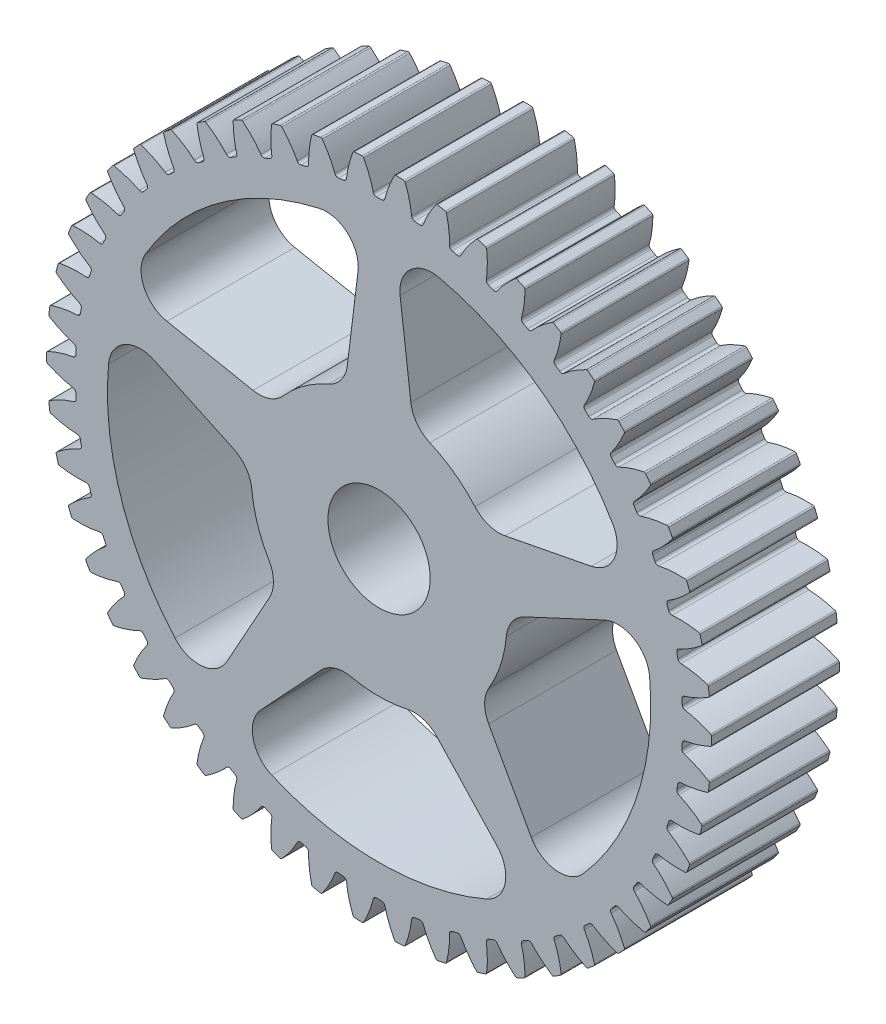
from build123d import *

# Parameters (mm, degrees)
SKETCH1_R                            = 33.02
BOSS_EXTRUDE1_DEPTH                  = 12.7
CUT_EXTRUDE_DCGTBC_DEPTH             = 49.393499563
FILLET_DCGTBC_R                      = 0.16191473
CIRPATTERN_DCGTBC_COUNT              = 50
FILLET_DCGTBC_OF_CIRPATTERN_DCGTBC_R = 0.16191473
SKETCH4_R                            = 4.7625
CUT_EXTRUDE2_DEPTH                   = 49.364303257
SKETCH5_R                            = 5.08
CUT_EXTRUDE3_DEPTH                   = 49.364303257
SKETCH6_R                            = 6.35
SKETCH6_R_2                          = 5.08
CUT_EXTRUDE4_DEPTH                   = 3.96875
CUT_EXTRUDE5_DEPTH                   = 49.364303257
FILLET1_R                            = 3.175


with BuildPart() as part:
    # Sketch1 → Boss-Extrude1 (new body)
    with BuildSketch(Plane.XY):
        Circle(SKETCH1_R)
    extrude(amount=BOSS_EXTRUDE1_DEPTH)

    # DCGTBC → Cut-Extrude-DCGTBC (cut, through all)
    with BuildSketch(Plane.XY):
        with BuildLine():
            add(Edge.make_bspline(
                [(0.580563674, 30.415867631), (0.583289779, 30.428308104), (0.591527209, 30.465389739), (0.605758164, 30.527010733), (0.626764487, 30.612909528), (0.657677609, 30.731586879), (0.69734407, 30.873764958), (0.747497392, 31.039747054), (0.808852297, 31.227743858), (0.876172182, 31.419057191), (0.946350906, 31.60706571), (1.021787923, 31.796724882), (1.097987154, 31.980017762), (1.181782633, 32.170079463), (1.26149249, 32.34535112), (1.355946347, 32.541342943), (1.433673918, 32.699400855), (1.518265424, 32.8623493), (1.560071309, 32.941609138), (1.581704198, 32.982095322)],
                knots=[0.16040477, 0.16040477, 0.16040477, 0.16040477, 0.16040477, 0.174208854, 0.201574956, 0.228941013, 0.256307345, 0.307035032, 0.361767352, 0.416499661, 0.471231937, 0.525964282, 0.580696616, 0.635428982, 0.690161387, 0.744893688, 0.799626082, 0.854358407, 0.909090914, 0.909090914, 0.909090914, 0.909090914, 0.909090914], degree=4))
            ThreePointArc((1.581704198, 32.982095322), (0, 33.02), (-1.581704198, 32.982095322))
            add(Edge.make_bspline(
                [(-0.580563674, 30.415867631), (-0.583289779, 30.428308104), (-0.591527209, 30.465389739), (-0.605758164, 30.527010733), (-0.626764487, 30.612909528), (-0.657677609, 30.731586879), (-0.69734407, 30.873764958), (-0.747497392, 31.039747054), (-0.808852297, 31.227743858), (-0.876172182, 31.419057191), (-0.946350906, 31.60706571), (-1.021787923, 31.796724882), (-1.097987154, 31.980017762), (-1.181782633, 32.170079463), (-1.26149249, 32.34535112), (-1.355946347, 32.541342943), (-1.433673918, 32.699400855), (-1.518265424, 32.8623493), (-1.560071309, 32.941609138), (-1.581704198, 32.982095322)],
                knots=[0.16040477, 0.16040477, 0.16040477, 0.16040477, 0.16040477, 0.174208854, 0.201574956, 0.228941013, 0.256307345, 0.307035032, 0.361767352, 0.416499661, 0.471231937, 0.525964282, 0.580696616, 0.635428982, 0.690161387, 0.744893688, 0.799626082, 0.854358407, 0.909090914, 0.909090914, 0.909090914, 0.909090914, 0.909090914], degree=4))
            ThreePointArc((-0.580563674, 30.415867631), (-0.466145503, 30.232005197), (-0.261433127, 30.161366994))
            ThreePointArc((-0.261433127, 30.161366994), (0, 30.1625), (0.261433127, 30.161366994))
            ThreePointArc((0.261433127, 30.161366994), (0.466145503, 30.232005197), (0.580563674, 30.415867631))
        make_face()
    cut_extrude_dcgtbc = extrude(amount=CUT_EXTRUDE_DCGTBC_DEPTH, mode=Mode.SUBTRACT)

    # Fillet-DCGTBC
    fillet_dcgtbc_edges = [part.edges().sort_by_distance(p)[0] for p in [
        (1.581704198, 32.982095322, 6.35),
        (-1.581704198, 32.982095322, 6.35),
    ]]
    fillet(fillet_dcgtbc_edges, radius=FILLET_DCGTBC_R)

    # CirPattern-DCGTBC: Cut-Extrude-DCGTBC ×50 about axis
    cirpattern_dcgtbc_axis = Axis((0, 0, 12.7), (0, 0, 1))
    for i in range(1, CIRPATTERN_DCGTBC_COUNT):
        add(cut_extrude_dcgtbc.rotate(cirpattern_dcgtbc_axis, i * 360 / CIRPATTERN_DCGTBC_COUNT), mode=Mode.SUBTRACT)

    # Fillet-DCGTBC of CirPattern-DCGTBC
    fillet_dcgtbc_of_cirpattern_dcgtbc_edges = [part.edges().sort_by_distance(p)[0] for p in [
        (-2.564520668, 32.920261751, 6.35),
        (-5.702984645, 32.523781547, 6.35),
        (-6.670301512, 32.339255986, 6.35),
        (-9.734325616, 31.552548309, 6.35),
        (-10.670887716, 31.248240836, 6.35),
        (-13.612150458, 30.083712535, 6.35),
        (-14.503187646, 29.664422261, 6.35),
        (-17.275303556, 28.140438644, 6.35),
        (-18.106763644, 27.612778027, 6.35),
        (-20.666014796, 25.753373224, 6.35),
        (-21.424785162, 25.125663788, 6.35),
        (-23.730810638, 22.960161725, 6.35),
        (-24.40492502, 22.242302821, 6.35),
        (-26.421357421, 19.80485476, 6.35),
        (-27.000184631, 19.008167452, 6.35),
        (-28.695223613, 16.337213404, 6.35),
        (-29.169635201, 15.474261928, 6.35),
        (-30.516548987, 12.611924433, 6.35),
        (-30.8790632, 11.696318049, 6.35),
        (-31.856610154, 8.68773788, 6.35),
        (-32.101509925, 7.733916247, 6.35),
        (-32.694273549, 4.626540511, 6.35),
        (-32.817696663, 3.649545967, 6.35),
        (-33.016328719, 0.492379834, 6.35),
        (-33.016328719, -0.492379834, 6.35),
        (-32.817696663, -3.649545967, 6.35),
        (-32.694273549, -4.626540511, 6.35),
        (-32.101509925, -7.733916247, 6.35),
        (-31.856610154, -8.68773788, 6.35),
        (-30.8790632, -11.696318049, 6.35),
        (-30.516548987, -12.611924433, 6.35),
        (-29.169635201, -15.474261928, 6.35),
        (-28.695223613, -16.337213404, 6.35),
        (-27.000184631, -19.008167452, 6.35),
        (-26.421357421, -19.80485476, 6.35),
        (-24.40492502, -22.242302821, 6.35),
        (-23.730810638, -22.960161725, 6.35),
        (-21.424785162, -25.125663788, 6.35),
        (-20.666014796, -25.753373224, 6.35),
        (-18.106763644, -27.612778027, 6.35),
        (-17.275303556, -28.140438644, 6.35),
        (-14.503187646, -29.664422261, 6.35),
        (-13.612150458, -30.083712535, 6.35),
        (-10.670887716, -31.248240836, 6.35),
        (-9.734325616, -31.552548309, 6.35),
        (-6.670301512, -32.339255986, 6.35),
        (-5.702984645, -32.523781547, 6.35),
        (-2.564520668, -32.920261751, 6.35),
        (-1.581704198, -32.982095322, 6.35),
        (1.581704198, -32.982095322, 6.35),
        (2.564520668, -32.920261751, 6.35),
        (5.702984645, -32.523781547, 6.35),
        (6.670301512, -32.339255986, 6.35),
        (9.734325616, -31.552548309, 6.35),
        (10.670887716, -31.248240836, 6.35),
        (13.612150458, -30.083712535, 6.35),
        (14.503187646, -29.664422261, 6.35),
        (17.275303556, -28.140438644, 6.35),
        (18.106763644, -27.612778027, 6.35),
        (20.666014796, -25.753373224, 6.35),
        (21.424785162, -25.125663788, 6.35),
        (23.730810638, -22.960161725, 6.35),
        (24.40492502, -22.242302821, 6.35),
        (26.421357421, -19.80485476, 6.35),
        (27.000184631, -19.008167452, 6.35),
        (28.695223613, -16.337213404, 6.35),
        (29.169635201, -15.474261928, 6.35),
        (30.516548987, -12.611924433, 6.35),
        (30.8790632, -11.696318049, 6.35),
        (31.856610154, -8.68773788, 6.35),
        (32.101509925, -7.733916247, 6.35),
        (32.694273549, -4.626540511, 6.35),
        (32.817696663, -3.649545967, 6.35),
        (33.016328719, -0.492379834, 6.35),
        (33.016328719, 0.492379834, 6.35),
        (32.817696663, 3.649545967, 6.35),
        (32.694273549, 4.626540511, 6.35),
        (32.101509925, 7.733916247, 6.35),
        (31.856610154, 8.68773788, 6.35),
        (30.8790632, 11.696318049, 6.35),
        (30.516548987, 12.611924433, 6.35),
        (29.169635201, 15.474261928, 6.35),
        (28.695223613, 16.337213404, 6.35),
        (27.000184631, 19.008167452, 6.35),
        (26.421357421, 19.80485476, 6.35),
        (24.40492502, 22.242302821, 6.35),
        (23.730810638, 22.960161725, 6.35),
        (21.424785162, 25.125663788, 6.35),
        (20.666014796, 25.753373224, 6.35),
        (18.106763644, 27.612778027, 6.35),
        (17.275303556, 28.140438644, 6.35),
        (14.503187646, 29.664422261, 6.35),
        (13.612150458, 30.083712535, 6.35),
        (10.670887716, 31.248240836, 6.35),
        (9.734325616, 31.552548309, 6.35),
        (6.670301512, 32.339255986, 6.35),
        (5.702984645, 32.523781547, 6.35),
        (2.564520668, 32.920261751, 6.35),
    ]]
    fillet(fillet_dcgtbc_of_cirpattern_dcgtbc_edges, radius=FILLET_DCGTBC_OF_CIRPATTERN_DCGTBC_R)

    # Sketch4 → Cut-Extrude2 (cut, through all)
    with BuildSketch(Plane.XY.offset(12.7)):
        Circle(SKETCH4_R)
    extrude(amount=-CUT_EXTRUDE2_DEPTH, mode=Mode.SUBTRACT)

    # Sketch5 → Cut-Extrude3 (cut, through all)
    with BuildSketch(Plane(origin=(0, 0, 0), x_dir=(-1, 0, 0), z_dir=(0, 0, -1))):
        Circle(SKETCH5_R)
    extrude(amount=-CUT_EXTRUDE3_DEPTH, mode=Mode.SUBTRACT)

    # Sketch6 → Cut-Extrude4 (cut)
    with BuildSketch(Plane(origin=(0, 0, 0), x_dir=(-1, 0, 0), z_dir=(0, 0, -1))):
        Circle(SKETCH6_R)
        Circle(SKETCH6_R_2, mode=Mode.SUBTRACT)
    extrude(amount=-CUT_EXTRUDE4_DEPTH, mode=Mode.SUBTRACT)

    # Sketch7 → Cut-Extrude5 (cut, through all)
    with BuildSketch(Plane.XY.offset(12.7)):
        with BuildLine():
            ThreePointArc((-10.59104217, 7.008553756), (-7.464872704, 10.274515829), (-3.392718701, 12.238441887))
            Line((-3.392718701, 12.238441887), (-1.5875, 26.940768363))
            ThreePointArc((-1.5875, 26.940768363), (-15.862854496, 21.833346136), (-25.131628827, 9.834957485))
            Line((-25.131628827, 9.834957485), (-10.59104217, 7.008553756))
        make_face()
        with BuildLine():
            Line((1.5875, 26.940768363), (3.392718701, 12.238441887))
            ThreePointArc((3.392718701, 12.238441887), (7.464872704, 10.274515829), (10.59104217, 7.008553756))
            Line((10.59104217, 7.008553756), (25.131628827, 9.834957485))
            ThreePointArc((25.131628827, 9.834957485), (15.862854496, 21.833346136), (1.5875, 26.940768363))
        make_face()
        with BuildLine():
            ThreePointArc((-9.938342738, -7.906917454), (-12.078417757, -3.924515829), (-12.687857641, 0.5552193))
            Line((-12.687857641, 0.5552193), (-26.112757784, 6.815353046))
            ThreePointArc((-26.112757784, 6.815353046), (-25.666637734, -8.339596136), (-17.119700808, -20.862430359))
            Line((-17.119700808, -20.862430359), (-9.938342738, -7.906917454))
        make_face()
        with BuildLine():
            Line((26.112757784, 6.815353046), (12.687857641, 0.5552193))
            ThreePointArc((12.687857641, 0.5552193), (12.078417757, -3.924515829), (9.938342738, -7.906917454))
            Line((9.938342738, -7.906917454), (17.119700808, -20.862430359))
            ThreePointArc((17.119700808, -20.862430359), (25.666637734, -8.339596136), (26.112757784, 6.815353046))
        make_face()
        with BuildLine():
            ThreePointArc((4.448808566, -11.895297489), (0, -12.7), (-4.448808566, -11.895297489))
            Line((-4.448808566, -11.895297489), (-14.551071851, -22.728648535))
            ThreePointArc((-14.551071851, -22.728648535), (0, -26.9875), (14.551071851, -22.728648535))
            Line((14.551071851, -22.728648535), (4.448808566, -11.895297489))
        make_face()
    extrude(amount=-CUT_EXTRUDE5_DEPTH, mode=Mode.SUBTRACT)

    # Fillet1
    fillet1_edges = [part.edges().sort_by_distance(p)[0] for p in [
        (-3.392718701, 12.238441887, 6.35),
        (-10.59104217, 7.008553756, 6.35),
        (-1.5875, 26.940768363, 6.35),
        (-25.131628827, 9.834957485, 6.35),
        (-9.938342738, -7.906917454, 6.35),
        (-12.687857641, 0.5552193, 6.35),
        (-26.112757784, 6.815353046, 6.35),
        (-17.119700808, -20.862430359, 6.35),
        (14.551071851, -22.728648535, 6.35),
        (-4.448808566, -11.895297489, 6.35),
        (4.448808566, -11.895297489, 6.35),
        (1.5875, 26.940768363, 6.35),
        (25.131628827, 9.834957485, 6.35),
        (26.112757784, 6.815353046, 6.35),
        (17.119700808, -20.862430359, 6.35),
        (-14.551071851, -22.728648535, 6.35),
        (12.687857641, 0.5552193, 6.35),
        (9.938342738, -7.906917454, 6.35),
        (10.59104217, 7.008553756, 6.35),
        (3.392718701, 12.238441887, 6.35),
    ]]
    fillet(fillet1_edges, radius=FILLET1_R)


solid = part.part
